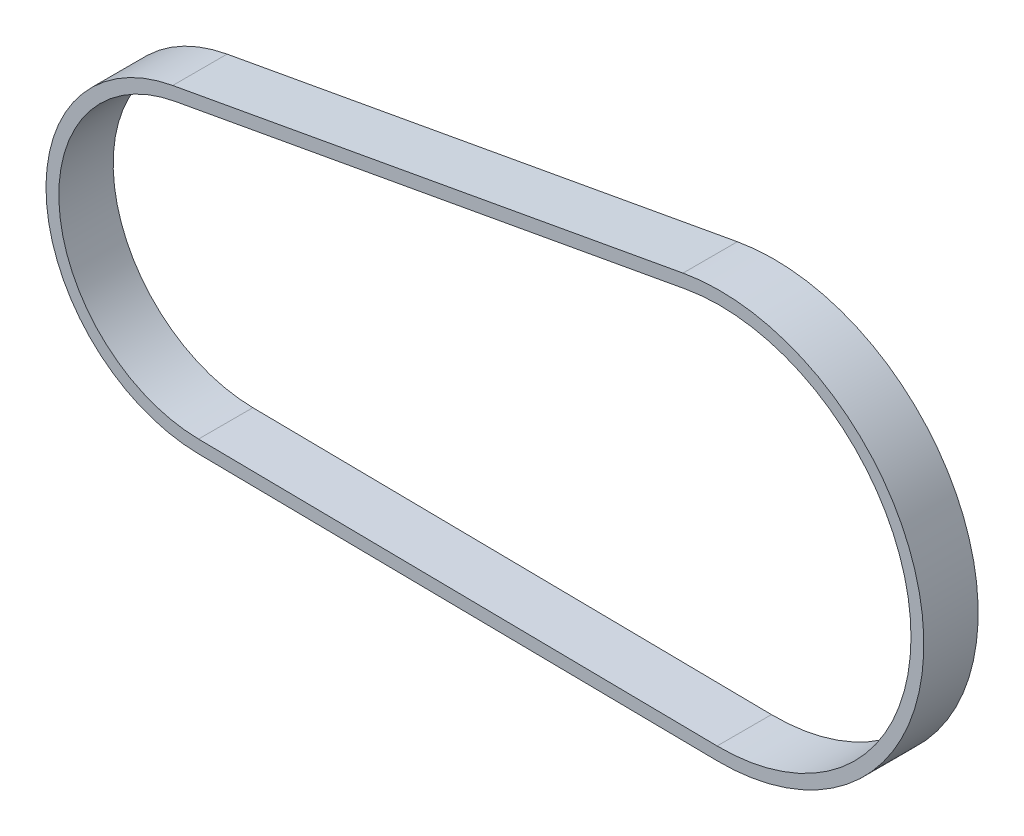
from build123d import *

# Parameters (mm, degrees)
EXTRUDE_THIN1_DEPTH = 3.175


with BuildPart() as part:
    # Sketch2 → Extrude-Thin1 (new, symmetric)
    with BuildSketch(Plane.XY):
        with BuildLine():
            Line((-3.221967142, 17.743846362), (56.409455673, 28.571852931))
            ThreePointArc((56.409455673, 28.571852931), (84.467913062, 7.072037518), (60.375149753, -18.794115076))
            Line((60.375149753, -18.794115076), (-0.226602465, -18.032576281))
            ThreePointArc((-0.226602465, -18.032576281), (-17.971123014, -1.504624082), (-3.221967142, 17.743846362))
        make_face()
        with BuildLine():
            Line((-2.953976086, 16.267980246), (56.677446729, 27.095986814))
            ThreePointArc((56.677446729, 27.095986814), (82.973142933, 6.94688857), (60.39399769, -17.294233496))
            Line((60.39399769, -17.294233496), (-0.207754528, -16.5326947))
            ThreePointArc((-0.207754528, -16.5326947), (-16.476352884, -1.379475135), (-2.953976086, 16.267980246))
        make_face(mode=Mode.SUBTRACT)
    extrude(amount=EXTRUDE_THIN1_DEPTH, both=True)


solid = part.part
